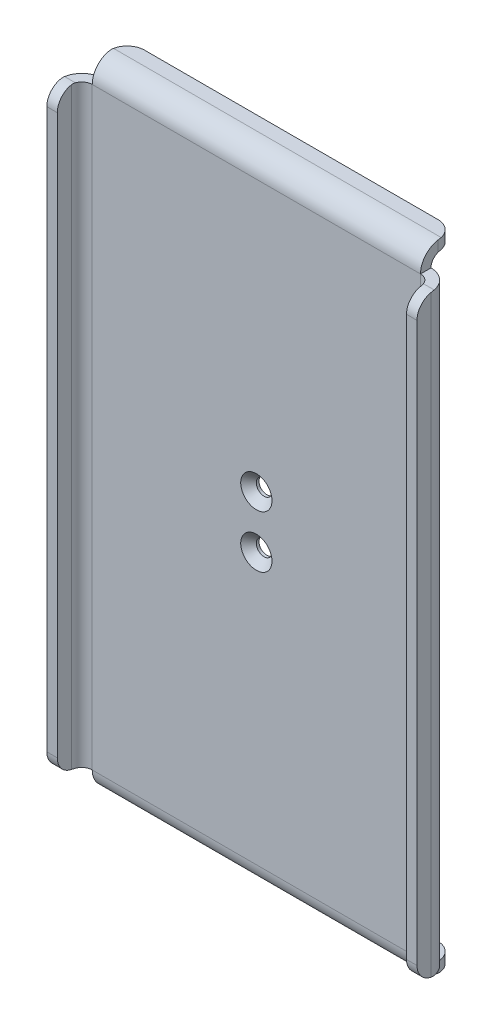
from build123d import *

# Parameters (mm, degrees)
SKETCH5_W                      = 100
SKETCH5_H                      = 170
BOSS_EXTRUDE2_DEPTH            = 1
CONVERT_SOLID1_START           = -50
CONVERT_SOLID1_OUTLINE_W       = 170
CONVERT_SOLID1_OUTLINE_H       = 2
CONVERT_SOLID1_DEPTH           = 100
CSK_FOR_M4_SFHCS1_AT_2_COUNT   = 2
CSK_FOR_M4_SFHCS1_AT_2_PITCH   = 15
EDGE_FLANGE3_STRIP_W           = 18
EDGE_FLANGE3_STRIP_H           = 3
EDGE_FLANGE3_STRIP_CUT_DEPTH   = 170
EDGE_FLANGE3_STRIP_2_W         = 18
EDGE_FLANGE3_STRIP_2_H         = 3
EDGE_FLANGE3_STRIP_CUT_2_DEPTH = 170
EDGE_FLANGE3_DEPTH             = 170
EDGE_FLANGE3_BEND_DEPTH        = 170
EDGE_FLANGE4_DEPTH             = 94
EDGE_FLANGE4_BEND_DEPTH        = 94
FILLET1_R                      = 5


# Read off the part's stored shape, not the designer's step: Convert-Solid1
# Sheet-metal steps are written as plain solids
with BuildPart() as part:
    # Sketch5 → Boss-Extrude2 (new body)
    with BuildSketch(Plane.XY):
        Rectangle(SKETCH5_W, SKETCH5_H)
    extrude(amount=BOSS_EXTRUDE2_DEPTH)

    # Convert-Solid1 outline → Convert-Solid1 (add)
    with BuildSketch(Plane.YZ.offset(CONVERT_SOLID1_START)):
        with Locations((0, -1)):
            Rectangle(CONVERT_SOLID1_OUTLINE_W, CONVERT_SOLID1_OUTLINE_H)
    extrude(amount=CONVERT_SOLID1_DEPTH)

    # Sketch23 → CSK for M4 SFHCS1 (revolve, cut)
    with BuildSketch(Plane(origin=(0, -7.5, 1), x_dir=(0, -1, 0), z_dir=(1, 0, 0))):
        Polygon((0, 0), (0, 3), (2.25, 3), (2.25, 2.23), (4.48, 0), align=None)
    csk_for_m4_sfhcs1 = revolve(axis=Axis((0, -7.5, 7.35), (0, 0, -1)), mode=Mode.SUBTRACT)

    # CSK for M4 SFHCS1 at 2: CSK for M4 SFHCS1 ×2
    with Locations(*[(0, i * CSK_FOR_M4_SFHCS1_AT_2_PITCH, 0) for i in range(1, CSK_FOR_M4_SFHCS1_AT_2_COUNT)]):
        add(csk_for_m4_sfhcs1, mode=Mode.SUBTRACT)

    # Edge-Flange3 strip (across the edge) → Edge-Flange3 strip cut (cut)
    with BuildSketch(Plane(origin=(50, -85, 1), x_dir=(-1, 0, 0), z_dir=(0, 1, 0))):
        with Locations((-6, -1.5)):
            Rectangle(EDGE_FLANGE3_STRIP_W, EDGE_FLANGE3_STRIP_H)
    extrude(amount=EDGE_FLANGE3_STRIP_CUT_DEPTH, mode=Mode.SUBTRACT)

    # Edge-Flange3 strip 2 (across the edge) → Edge-Flange3 strip cut 2 (cut)
    with BuildSketch(Plane(origin=(-50, 85, 1), x_dir=(1, 0, 0), z_dir=(0, -1, 0))):
        with Locations((-6, -1.5)):
            Rectangle(EDGE_FLANGE3_STRIP_2_W, EDGE_FLANGE3_STRIP_2_H)
    extrude(amount=EDGE_FLANGE3_STRIP_CUT_2_DEPTH, mode=Mode.SUBTRACT)

    # Edge-Flange3 section (across the edge) → Edge-Flange3 (add)
    with BuildSketch(Plane(origin=(50, -85, 1), x_dir=(-1, 0, 0), z_dir=(0, 1, 0))):
        with BuildLine():
            Line((-3, 3), (-3, 7))
            Line((-3, 7), (0, 7))
            Line((0, 7), (0, 3))
            ThreePointArc((0, 3), (0.878679656, 0.878679656), (3, 0))
            Line((3, 0), (3, -3))
            ThreePointArc((3, -3), (-1.242640687, -1.242640687), (-3, 3))
        make_face()
    extrude(amount=EDGE_FLANGE3_DEPTH)

    # Edge-Flange3 section 2 (across the edge) → Edge-Flange3 bend (add)
    with BuildSketch(Plane(origin=(-50, 85, 1), x_dir=(1, 0, 0), z_dir=(0, -1, 0))):
        with BuildLine():
            Line((-3, 3), (-3, 7))
            Line((-3, 7), (0, 7))
            Line((0, 7), (0, 3))
            ThreePointArc((0, 3), (0.878679656, 0.878679656), (3, 0))
            Line((3, 0), (3, -3))
            ThreePointArc((3, -3), (-1.242640687, -1.242640687), (-3, 3))
        make_face()
    extrude(amount=EDGE_FLANGE3_BEND_DEPTH)

    # Edge-Flange4 section (across the edge) → Edge-Flange4 (add)
    with BuildSketch(Plane(origin=(47, -88, -2), x_dir=(0, 1, 0), z_dir=(-1, 0, 0))):
        with BuildLine():
            Line((-3, 3), (-3, 7))
            Line((-3, 7), (0, 7))
            Line((0, 7), (0, 3))
            ThreePointArc((0, 3), (0.878679656, 0.878679656), (3, 0))
            Line((3, 0), (3, -3))
            ThreePointArc((3, -3), (-1.242640687, -1.242640687), (-3, 3))
        make_face()
    extrude(amount=EDGE_FLANGE4_DEPTH)

    # Edge-Flange4 section 2 (across the edge) → Edge-Flange4 bend (add)
    with BuildSketch(Plane(origin=(-47, 88, -2), x_dir=(0, -1, 0), z_dir=(1, 0, 0))):
        with BuildLine():
            Line((-3, 3), (-3, 7))
            Line((-3, 7), (0, 7))
            Line((0, 7), (0, 3))
            ThreePointArc((0, 3), (0.878679656, 0.878679656), (3, 0))
            Line((3, 0), (3, -3))
            ThreePointArc((3, -3), (-1.242640687, -1.242640687), (-3, 3))
        make_face()
    extrude(amount=EDGE_FLANGE4_BEND_DEPTH)

    # Fillet1
    fillet1_edges = [part.edges().sort_by_distance(p)[0] for p in [
        (51.5, -85, 8),
        (51.5, 85, 8),
        (47, 89.5, -9),
        (-47, 89.5, -9),
        (-51.5, 85, 8),
        (-51.5, -85, 8),
        (-47, -89.5, -9),
        (47, -89.5, -9),
    ]]
    fillet(fillet1_edges, radius=FILLET1_R)


solid = part.part
